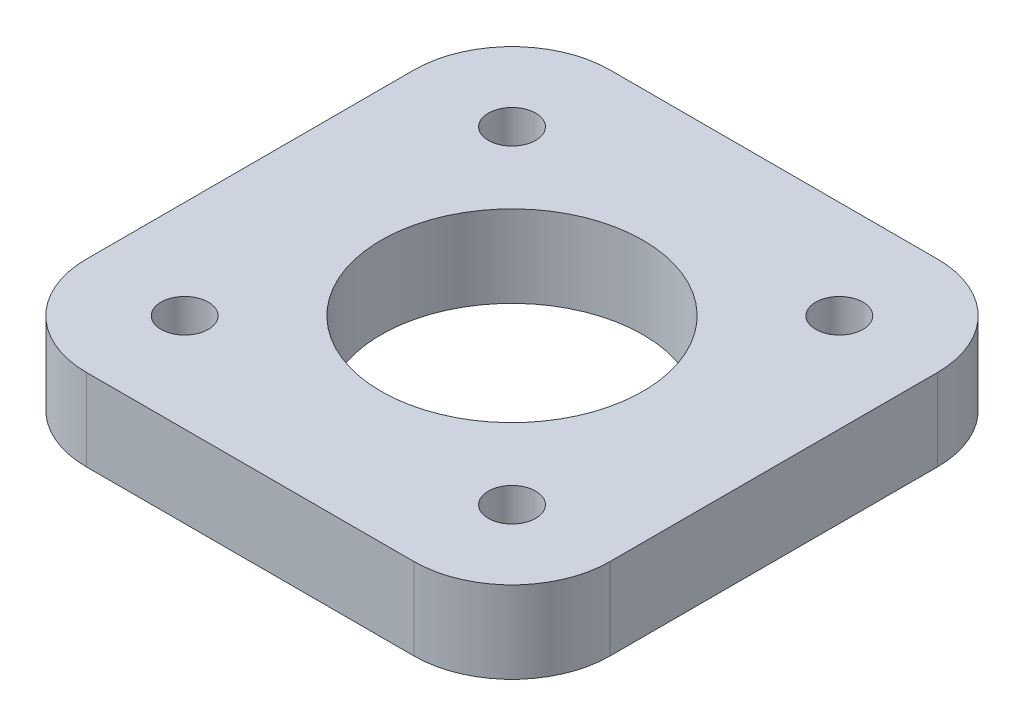
from build123d import *

# Parameters (mm, degrees)
SKETCH1_R           = 8
SKETCH1_R_2         = 1.445711851
BOSS_EXTRUDE1_DEPTH = 5


with BuildPart() as part:
    # Sketch1 → Boss-Extrude1 (new body)
    with BuildSketch(Plane(origin=(0, 0, 0), x_dir=(1, 0, 0), z_dir=(0, 1, 0))):
        with BuildLine():
            Line((-10, 16), (10, 16))
            ThreePointArc((10, 16), (14.242640687, 14.242640687), (16, 10))
            Line((16, 10), (16, -10))
            ThreePointArc((16, -10), (14.242640687, -14.242640687), (10, -16))
            Line((10, -16), (-10, -16))
            ThreePointArc((-10, -16), (-14.242640687, -14.242640687), (-16, -10))
            Line((-16, -10), (-16, 10))
            ThreePointArc((-16, 10), (-14.242640687, 14.242640687), (-10, 16))
        make_face()
        Circle(SKETCH1_R, mode=Mode.SUBTRACT)
        with Locations((-10, 10)):
            Circle(SKETCH1_R_2, mode=Mode.SUBTRACT)
        with Locations((10, 10)):
            Circle(SKETCH1_R_2, mode=Mode.SUBTRACT)
        with Locations((10, -10)):
            Circle(SKETCH1_R_2, mode=Mode.SUBTRACT)
        with Locations((-10, -10)):
            Circle(SKETCH1_R_2, mode=Mode.SUBTRACT)
    extrude(amount=-BOSS_EXTRUDE1_DEPTH)


solid = part.part
